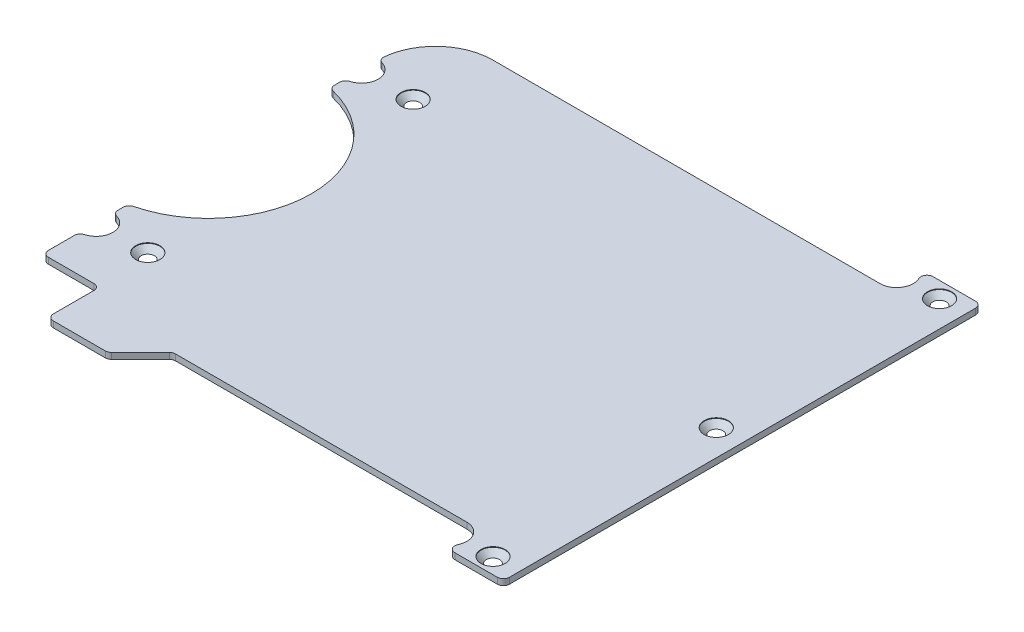
from build123d import *

# Parameters (mm, degrees)
SKETCH1_R                  = 1
BASE_SHAPE_DEPTH           = 0.5
FILLETS_R                  = 1
M2_COUNTERSUNKS_AT_2_COUNT = 2
M2_COUNTERSUNKS_AT_2_PITCH = 73.76
M2_COUNTERSUNKS_AT_3_COUNT = 2
M2_COUNTERSUNKS_AT_3_PITCH = 73.537756289
M2_COUNTERSUNKS_AT_4_COUNT = 2
M2_COUNTERSUNKS_AT_4_PITCH = 92.959345953
M2_COUNTERSUNKS_AT_5_COUNT = 2
M2_COUNTERSUNKS_AT_5_PITCH = 36.88


with BuildPart() as part:
    # Sketch1 → Base shape (new, symmetric)
    with BuildSketch(Plane(origin=(0, 0, 0), x_dir=(1, 0, 0), z_dir=(0, 1, 0))):
        with BuildLine():
            ThreePointArc((2.75, 36.88), (1.944543648, 34.935456352), (0, 34.13))
            Line((0, 34.13), (-63.992025159, 34.13))
            ThreePointArc((-63.992025159, 34.13), (-70.681255309, 31.35923015), (-73.452025159, 24.67))
            ThreePointArc((-73.452025159, 24.67), (-71.507481511, 23.864543648), (-70.702025159, 21.92))
            ThreePointArc((-70.702025159, 21.92), (-71.507481511, 19.975456352), (-73.452025159, 19.17))
            Line((-73.452025159, 19.17), (-73.452025159, 16.662625843))
            ThreePointArc((-73.452025159, 16.662625843), (-63.663567803, 10.763596053), (-59.822025159, 0))
            ThreePointArc((-59.822025159, 0), (-63.663567803, -10.763596053), (-73.452025159, -16.662625843))
            Line((-73.452025159, -16.662625843), (-73.452025159, -19.17))
            ThreePointArc((-73.452025159, -19.17), (-71.507481511, -19.975456352), (-70.702025159, -21.92))
            ThreePointArc((-70.702025159, -21.92), (-71.507481511, -23.864543648), (-73.452025159, -24.67))
            Line((-73.452025159, -24.67), (-73.452025159, -30.8))
            Line((-73.452025159, -30.8), (-63.952025159, -30.8))
            Line((-63.952025159, -30.8), (-63.952025159, -34.13))
            Line((-63.952025159, -34.13), (-63.952025159, -39.5))
            Line((-63.952025159, -39.5), (-53.952025159, -39.5))
            Line((-53.952025159, -39.5), (-48.582025159, -34.13))
            Line((-48.582025159, -34.13), (0, -34.13))
            ThreePointArc((0, -34.13), (1.944543648, -34.935456352), (2.75, -36.88))
            ThreePointArc((2.75, -36.88), (2.220381771, -38.502468734), (0.835523788, -39.5))
            Line((0.835523788, -39.5), (11.4, -39.5))
            Line((11.4, -39.5), (11.4, 39.5))
            Line((11.4, 39.5), (0.835523788, 39.5))
            ThreePointArc((0.835523788, 39.5), (2.220381771, 38.502468734), (2.75, 36.88))
        make_face()
        with Locations((-64.925, -21.92)):
            Circle(SKETCH1_R, mode=Mode.SUBTRACT)
        with Locations((7.075, -36.88)):
            Circle(SKETCH1_R, mode=Mode.SUBTRACT)
        with Locations((-64.925, 21.92)):
            Circle(SKETCH1_R, mode=Mode.SUBTRACT)
        with Locations((7.075, 0)):
            Circle(SKETCH1_R, mode=Mode.SUBTRACT)
        with Locations((7.075, 36.88)):
            Circle(SKETCH1_R, mode=Mode.SUBTRACT)
    extrude(amount=BASE_SHAPE_DEPTH, both=True)

    # Fillets
    fillets_edges = [part.edges().sort_by_distance(p)[0] for p in [
        (-48.582025159, -0.25, 34.13),
        (-53.952025159, -0.25, 39.5),
        (-73.452025159, -0.25, -24.67),
        (-73.452025159, -0.25, -19.17),
        (-73.452025159, -0.25, -16.662625843),
        (-73.452025159, -0.25, 24.67),
        (-73.452025159, -0.25, 19.17),
        (-73.452025159, -0.25, 16.662625843),
        (-73.452025159, -0.25, 30.8),
        (-63.952025159, -0.25, 30.8),
        (0.835523788, -0.25, -39.5),
        (0.835523788, -0.25, 39.5),
        (11.4, -0.25, -39.5),
        (11.4, -0.25, 39.5),
        (-63.952025159, -0.25, 39.5),
    ]]
    fillet(fillets_edges, radius=FILLETS_R)

    # Sketch3 → M2 countersunks (revolve, cut)
    with BuildSketch(Plane(origin=(7.075, -0.5, -36.88), x_dir=(0, 0, -1), z_dir=(1, 0, 0))):
        Polygon((0, 0), (0, 1), (1, 1), (1, 1.1), (2, 0.1), (2, 0), align=None)
    m2_countersunks = revolve(axis=Axis((7.075, -6.85, -36.88), (0, 1, 0)), mode=Mode.SUBTRACT)

    # M2 countersunks at 2: M2 countersunks ×2
    with Locations(*[(0, 0, i * M2_COUNTERSUNKS_AT_2_PITCH) for i in range(1, M2_COUNTERSUNKS_AT_2_COUNT)]):
        add(m2_countersunks, mode=Mode.SUBTRACT)

    # M2 countersunks at 3: M2 countersunks ×2
    with Locations(*[Vector(-0.9790888875801275, 0, 0.2034329133083154) * (i * M2_COUNTERSUNKS_AT_3_PITCH) for i in range(1, M2_COUNTERSUNKS_AT_3_COUNT)]):
        add(m2_countersunks, mode=Mode.SUBTRACT)

    # M2 countersunks at 4: M2 countersunks ×2
    with Locations(*[Vector(-0.7745321275866415, 0, 0.6325345708624239) * (i * M2_COUNTERSUNKS_AT_4_PITCH) for i in range(1, M2_COUNTERSUNKS_AT_4_COUNT)]):
        add(m2_countersunks, mode=Mode.SUBTRACT)

    # M2 countersunks at 5: M2 countersunks ×2
    with Locations(*[(0, 0, i * M2_COUNTERSUNKS_AT_5_PITCH) for i in range(1, M2_COUNTERSUNKS_AT_5_COUNT)]):
        add(m2_countersunks, mode=Mode.SUBTRACT)


with BuildPart() as body_2:
    # Mirror1: mirrored copy
    add(part.part.mirror(Plane.ZX))


solid = body_2.part
